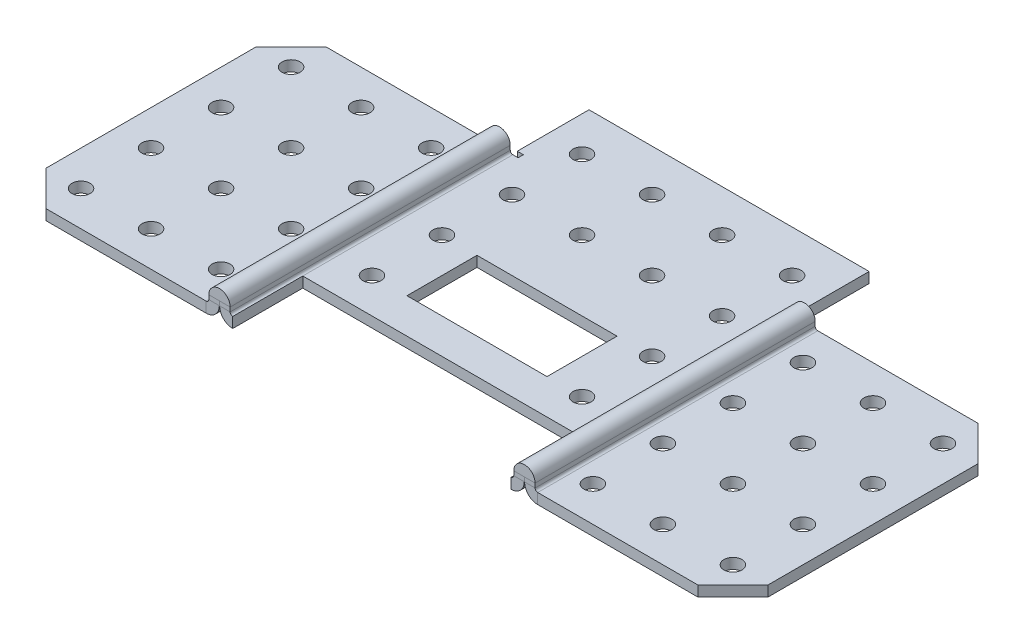
from build123d import *

# Parameters (mm, degrees)
BASE_FLANGE1_DEPTH              = 3
EDGE_FLANGE1_STRIP_W            = 13.4732
EDGE_FLANGE1_STRIP_H            = 3
EDGE_FLANGE1_STRIP_CUT_DEPTH    = 80
EDGE_FLANGE1_RELIEF_W           = 14.9732
EDGE_FLANGE1_RELIEF_H           = 1.5
EDGE_FLANGE1_RELIEF_CUT_DEPTH   = 3
EDGE_FLANGE1_STRIP_2_W          = 13.4732
EDGE_FLANGE1_STRIP_2_H          = 3
EDGE_FLANGE1_STRIP_CUT_2_DEPTH  = 80
EDGE_FLANGE1_RELIEF_2_W         = 14.9732
EDGE_FLANGE1_RELIEF_2_H         = 1.5
EDGE_FLANGE1_RELIEF_CUT_2_DEPTH = 3
EDGE_FLANGE1_DEPTH              = 80
EDGE_FLANGE1_BEND_DEPTH         = 80
HEM1_START                      = -51.311042424
HEM1_DEPTH                      = 80
HEM1_2_DEPTH                    = 80
EDGE_FLANGE2_STRIP_W            = 13.4732
EDGE_FLANGE2_STRIP_H            = 3
EDGE_FLANGE2_STRIP_CUT_DEPTH    = 80
EDGE_FLANGE2_STRIP_2_W          = 13.4732
EDGE_FLANGE2_STRIP_2_H          = 3
EDGE_FLANGE2_STRIP_CUT_2_DEPTH  = 80
EDGE_FLANGE2_DEPTH              = 80
EDGE_FLANGE2_BEND_DEPTH         = 80
CHAMFER1_SIZE                   = 10
SKETCH24_W                      = 40
SKETCH24_H                      = 20
CUT_EXTRUDE1_DEPTH              = 3
SKETCH25_R                      = 2.58
CUT_EXTRUDE3_DEPTH              = 3
CUT_EXTRUDE2_START              = -3
CUT_EXTRUDE2_OUTLINE_W          = 79.5268
CUT_EXTRUDE2_OUTLINE_H          = 20
CUT_EXTRUDE2_DEPTH              = 3


# Read off the part's stored shape, not the designer's step: Hem1, Cut-Extrude2
# Sheet-metal steps are written as plain solids
with BuildPart() as part:
    # Sketch1 → Base-Flange1 (new body)
    with BuildSketch(Plane(origin=(0, 0, 0), x_dir=(1, 0, 0), z_dir=(0, 1, 0))):
        Polygon((-40.5, 51.311042424), (-40.5, -28.688957576), (40.5, -28.688957576), (40.5, 51.311042424), (40, 51.311042424), (40, 73.311042424), (-40, 73.311042424), (-40, 51.311042424), align=None)
    extrude(amount=-BASE_FLANGE1_DEPTH)

    # Edge-Flange1 strip (across the edge) → Edge-Flange1 strip cut (cut)
    with BuildSketch(Plane(origin=(40.5, 0, 28.688957576), x_dir=(-1, 0, 0), z_dir=(0, 0, -1))):
        with Locations((-6, -1.5)):
            Rectangle(EDGE_FLANGE1_STRIP_W, EDGE_FLANGE1_STRIP_H)
    extrude(amount=EDGE_FLANGE1_STRIP_CUT_DEPTH, mode=Mode.SUBTRACT)

    # Edge-Flange1 relief (on the sheet) → Edge-Flange1 relief cut (cut)
    with BuildSketch(Plane(origin=(39.7634, 0, 28.688957576), x_dir=(-1, 0, 0), z_dir=(0, 1, 0))):
        with Locations((-5.9866, -80.75)):
            Rectangle(EDGE_FLANGE1_RELIEF_W, EDGE_FLANGE1_RELIEF_H)
    extrude(amount=-EDGE_FLANGE1_RELIEF_CUT_DEPTH, mode=Mode.SUBTRACT)

    # Edge-Flange1 strip 2 (across the edge) → Edge-Flange1 strip cut 2 (cut)
    with BuildSketch(Plane(origin=(-40.5, 0, -51.311042424), x_dir=(1, 0, 0), z_dir=(0, 0, 1))):
        with Locations((-6, -1.5)):
            Rectangle(EDGE_FLANGE1_STRIP_2_W, EDGE_FLANGE1_STRIP_2_H)
    extrude(amount=EDGE_FLANGE1_STRIP_CUT_2_DEPTH, mode=Mode.SUBTRACT)

    # Edge-Flange1 relief 2 (on the sheet) → Edge-Flange1 relief cut 2 (cut)
    with BuildSketch(Plane(origin=(-39.7634, 0, -51.311042424), x_dir=(1, 0, 0), z_dir=(0, 1, 0))):
        with Locations((-5.9866, 0.75)):
            Rectangle(EDGE_FLANGE1_RELIEF_2_W, EDGE_FLANGE1_RELIEF_2_H)
    extrude(amount=-EDGE_FLANGE1_RELIEF_CUT_2_DEPTH, mode=Mode.SUBTRACT)

    # Edge-Flange1 section (across the edge) → Edge-Flange1 (add)
    with BuildSketch(Plane(origin=(40.5, 0, 28.688957576), x_dir=(-1, 0, 0), z_dir=(0, 0, -1))):
        with BuildLine():
            Line((-3, 0.7366), (-3, 5))
            Line((-3, 5), (0, 5))
            Line((0, 5), (0, 0.7366))
            ThreePointArc((0, 0.7366), (0.215745145, 0.215745145), (0.7366, 0))
            Line((0.7366, 0), (0.7366, -3))
            ThreePointArc((0.7366, -3), (-1.905575199, -1.905575199), (-3, 0.7366))
        make_face()
    extrude(amount=EDGE_FLANGE1_DEPTH)

    # Edge-Flange1 section 2 (across the edge) → Edge-Flange1 bend (add)
    with BuildSketch(Plane(origin=(-40.5, 0, -51.311042424), x_dir=(1, 0, 0), z_dir=(0, 0, 1))):
        with BuildLine():
            Line((-3, 0.7366), (-3, 5))
            Line((-3, 5), (0, 5))
            Line((0, 5), (0, 0.7366))
            ThreePointArc((0, 0.7366), (0.215745145, 0.215745145), (0.7366, 0))
            Line((0.7366, 0), (0.7366, -3))
            ThreePointArc((0.7366, -3), (-1.905575199, -1.905575199), (-3, 0.7366))
        make_face()
    extrude(amount=EDGE_FLANGE1_BEND_DEPTH)

    # Hem1 outline → Hem1 (cut)
    with BuildSketch(Plane.XY.offset(HEM1_START)):
        with BuildLine():
            ThreePointArc((40.5, 1.95), (41.375718509, 4.088924964), (43.5, 4.999590136))
            Line((43.5, 4.999590136), (43.5, 5))
            Line((43.5, 5), (40.5, 5))
            Line((40.5, 5), (40.5, 1.95))
        make_face()
        with BuildLine():
            Line((-43.5, 5), (-43.5, 4.999590136))
            ThreePointArc((-43.5, 4.999590136), (-41.375718509, 4.088924964), (-40.5, 1.95))
            Line((-40.5, 1.95), (-40.5, 5))
            Line((-40.5, 5), (-43.5, 5))
        make_face()
    extrude(amount=HEM1_DEPTH, mode=Mode.SUBTRACT)

    # Hem1 2 outline → Hem1 2 (add)
    with BuildSketch(Plane.XY.offset(HEM1_START)):
        with BuildLine():
            Line((43.6, -3), (46.6, -3))
            Line((46.6, -3), (46.6, 1.95))
            ThreePointArc((46.6, 1.95), (45.688924964, 4.124281491), (43.5, 4.999590136))
            Line((43.5, 4.999590136), (43.5, 1.95))
            ThreePointArc((43.5, 1.95), (43.55, 2), (43.6, 1.95))
            Line((43.6, 1.95), (43.6, -3))
        make_face()
        with BuildLine():
            Line((-46.6, -3), (-43.6, -3))
            Line((-43.6, -3), (-43.6, 1.95))
            ThreePointArc((-43.6, 1.95), (-43.55, 2), (-43.5, 1.95))
            Line((-43.5, 1.95), (-43.5, 4.999590136))
            ThreePointArc((-43.5, 4.999590136), (-45.688924964, 4.124281491), (-46.6, 1.95))
            Line((-46.6, 1.95), (-46.6, -3))
        make_face()
    extrude(amount=HEM1_2_DEPTH)

    # Edge-Flange2 strip (across the edge) → Edge-Flange2 strip cut (cut)
    with BuildSketch(Plane(origin=(46.6, -3, 28.688957576), x_dir=(0, 1, 0), z_dir=(0, 0, -1))):
        with Locations((-3, -1.5)):
            Rectangle(EDGE_FLANGE2_STRIP_W, EDGE_FLANGE2_STRIP_H)
    extrude(amount=EDGE_FLANGE2_STRIP_CUT_DEPTH, mode=Mode.SUBTRACT)

    # Edge-Flange2 strip 2 (across the edge) → Edge-Flange2 strip cut 2 (cut)
    with BuildSketch(Plane(origin=(-46.6, -3, -51.311042424), x_dir=(0, 1, 0), z_dir=(0, 0, 1))):
        with Locations((-3, -1.5)):
            Rectangle(EDGE_FLANGE2_STRIP_2_W, EDGE_FLANGE2_STRIP_2_H)
    extrude(amount=EDGE_FLANGE2_STRIP_CUT_2_DEPTH, mode=Mode.SUBTRACT)

    # Edge-Flange2 section (across the edge) → Edge-Flange2 (add)
    with BuildSketch(Plane(origin=(46.6, -3, 28.688957576), x_dir=(0, 1, 0), z_dir=(0, 0, -1))):
        with BuildLine():
            Line((0, 0.7366), (0, 56.5))
            Line((0, 56.5), (3, 56.5))
            Line((3, 56.5), (3, 0.7366))
            ThreePointArc((3, 0.7366), (3.215745145, 0.215745145), (3.7366, 0))
            Line((3.7366, 0), (3.7366, -3))
            ThreePointArc((3.7366, -3), (1.094424801, -1.905575199), (0, 0.7366))
        make_face()
    extrude(amount=EDGE_FLANGE2_DEPTH)

    # Edge-Flange2 section 2 (across the edge) → Edge-Flange2 bend (add)
    with BuildSketch(Plane(origin=(-46.6, -3, -51.311042424), x_dir=(0, 1, 0), z_dir=(0, 0, 1))):
        with BuildLine():
            Line((0, 0.7366), (0, 56.5))
            Line((0, 56.5), (3, 56.5))
            Line((3, 56.5), (3, 0.7366))
            ThreePointArc((3, 0.7366), (3.215745145, 0.215745145), (3.7366, 0))
            Line((3.7366, 0), (3.7366, -3))
            ThreePointArc((3.7366, -3), (1.094424801, -1.905575199), (0, 0.7366))
        make_face()
    extrude(amount=EDGE_FLANGE2_BEND_DEPTH)

    # Chamfer1
    chamfer1_edges = [part.edges().sort_by_distance(p)[0] for p in [
        (103.1, -1.5, 28.688957576),
        (103.1, -1.5, -51.311042424),
        (-103.1, -1.5, -51.311042424),
        (-103.1, -1.5, 28.688957576),
    ]]
    chamfer(chamfer1_edges, length=CHAMFER1_SIZE)

    # Sketch24 → Cut-Extrude1 (cut)
    with BuildSketch(Plane(origin=(0, 0, 0), x_dir=(1, 0, 0), z_dir=(0, 1, 0))):
        with Locations((0, 11.311042424)):
            Rectangle(SKETCH24_W, SKETCH24_H)
    extrude(amount=-CUT_EXTRUDE1_DEPTH, mode=Mode.SUBTRACT)

    # Sketch25 → Cut-Extrude3 (cut)
    with BuildSketch(Plane(origin=(0, 0, 0), x_dir=(1, 0, 0), z_dir=(0, 1, 0))):
        with Locations(Location((-30, 61.311042424, 0), (0, 0, 270))):
            Circle(SKETCH25_R)
        with Locations(Location((-10, 61.311042424, 0), (0, 0, 270))):
            Circle(SKETCH25_R)
        with Locations(Location((10, 61.311042424, 0), (0, 0, 270))):
            Circle(SKETCH25_R)
        with Locations(Location((30, 61.311042424, 0), (0, 0, 270))):
            Circle(SKETCH25_R)
        with Locations(Location((30, 41.311042424, 0), (0, 0, 270))):
            Circle(SKETCH25_R)
        with Locations(Location((10, 41.311042424, 0), (0, 0, 270))):
            Circle(SKETCH25_R)
        with Locations(Location((-10, 41.311042424, 0), (0, 0, 270))):
            Circle(SKETCH25_R)
        with Locations(Location((-30, 41.311042424, 0), (0, 0, 270))):
            Circle(SKETCH25_R)
        with Locations(Location((-30, 21.311042424, 0), (0, 0, 270))):
            Circle(SKETCH25_R)
        with Locations(Location((-30, 1.311042424, 0), (0, 0, 270))):
            Circle(SKETCH25_R)
        with Locations(Location((30, 21.311042424, 0), (0, 0, 270))):
            Circle(SKETCH25_R)
        with Locations(Location((30, 1.311042424, 0), (0, 0, 270))):
            Circle(SKETCH25_R)
        with Locations(Location((-93.1, 41.311042424, 0), (0, 0, 270))):
            Circle(SKETCH25_R)
        with Locations(Location((-73.1, 41.311042424, 0), (0, 0, 270))):
            Circle(SKETCH25_R)
        with Locations(Location((-53.1, 41.311042424, 0), (0, 0, 270))):
            Circle(SKETCH25_R)
        with Locations(Location((-93.1, 21.311042424, 0), (0, 0, 270))):
            Circle(SKETCH25_R)
        with Locations(Location((-73.1, 21.311042424, 0), (0, 0, 270))):
            Circle(SKETCH25_R)
        with Locations(Location((-53.1, 21.311042424, 0), (0, 0, 270))):
            Circle(SKETCH25_R)
        with Locations(Location((-93.1, 1.311042424, 0), (0, 0, 270))):
            Circle(SKETCH25_R)
        with Locations(Location((-73.1, 1.311042424, 0), (0, 0, 270))):
            Circle(SKETCH25_R)
        with Locations(Location((-53.1, 1.311042424, 0), (0, 0, 270))):
            Circle(SKETCH25_R)
        with Locations(Location((-53.1, -18.688957576, 0), (0, 0, 270))):
            Circle(SKETCH25_R)
        with Locations(Location((-73.1, -18.688957576, 0), (0, 0, 270))):
            Circle(SKETCH25_R)
        with Locations(Location((-93.1, -18.688957576, 0), (0, 0, 270))):
            Circle(SKETCH25_R)
        with Locations(Location((53.1, 41.311042424, 0), (0, 0, 270))):
            Circle(SKETCH25_R)
        with Locations(Location((73.1, 41.311042424, 0), (0, 0, 270))):
            Circle(SKETCH25_R)
        with Locations(Location((93.1, 41.311042424, 0), (0, 0, 270))):
            Circle(SKETCH25_R)
        with Locations(Location((53.1, 21.311042424, 0), (0, 0, 270))):
            Circle(SKETCH25_R)
        with Locations(Location((73.1, 21.311042424, 0), (0, 0, 270))):
            Circle(SKETCH25_R)
        with Locations(Location((93.1, 21.311042424, 0), (0, 0, 270))):
            Circle(SKETCH25_R)
        with Locations(Location((53.1, 1.311042424, 0), (0, 0, 270))):
            Circle(SKETCH25_R)
        with Locations(Location((73.1, 1.311042424, 0), (0, 0, 270))):
            Circle(SKETCH25_R)
        with Locations(Location((93.1, 1.311042424, 0), (0, 0, 270))):
            Circle(SKETCH25_R)
        with Locations(Location((53.1, -18.688957576, 0), (0, 0, 270))):
            Circle(SKETCH25_R)
        with Locations(Location((73.1, -18.688957576, 0), (0, 0, 270))):
            Circle(SKETCH25_R)
        with Locations(Location((93.1, -18.688957576, 0), (0, 0, 270))):
            Circle(SKETCH25_R)
    extrude(amount=-CUT_EXTRUDE3_DEPTH, mode=Mode.SUBTRACT)

    # Cut-Extrude2 outline → Cut-Extrude2 (cut)
    with BuildSketch(Plane(origin=(0, 0, 0), x_dir=(1, 0, 0), z_dir=(0, 1, 0)).offset(CUT_EXTRUDE2_START)):
        with Locations((0, -18.688957576)):
            Rectangle(CUT_EXTRUDE2_OUTLINE_W, CUT_EXTRUDE2_OUTLINE_H)
    extrude(amount=CUT_EXTRUDE2_DEPTH, mode=Mode.SUBTRACT)


solid = part.part
